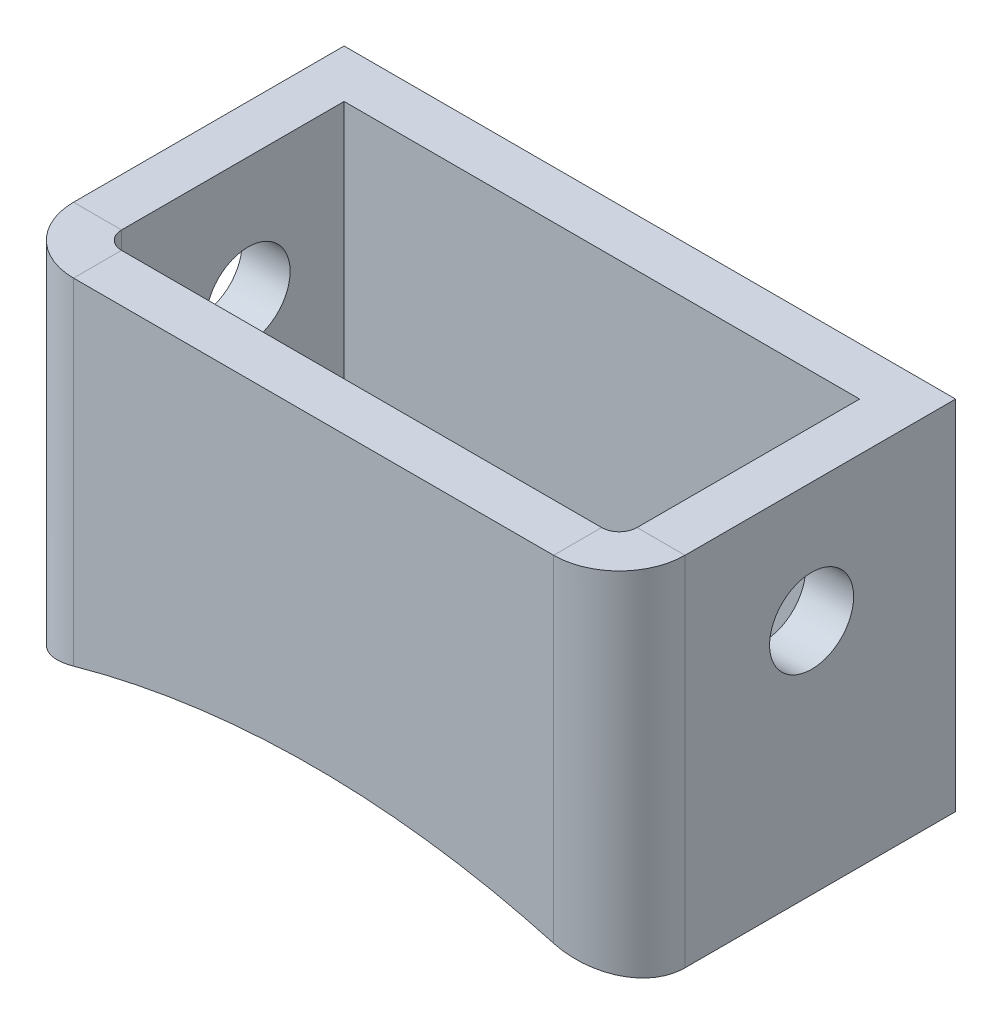
from build123d import *

# Parameters (mm, degrees)
SKETCH1_R                  = 1.75
BASE_FLANGE1_DEPTH         = 2
SKETCHED_START             = -8.2
SKETCHED_BEND1_DEPTH       = 15.2
SKETCHED_BEND1_2_DEPTH     = 8.4499999
SKETCHED_START_2           = 3.7500001
SKETCHED_BEND1_3_DEPTH     = 3.2499999
SKETCHED_START_3           = 0.2499999
SKETCHED_BEND1_4_DEPTH     = 3.5000002
SKETCHED_START_4           = -12.7366
SKETCHED_BEND1_5_OUTLINE_R = 1.75
SKETCHED_BEND1_5_DEPTH     = 25.4732
SKETCH7_R                  = 37
CUT_EXTRUDE1_DEPTH         = 20.330576261
BOSS_EXTRUDE1_DEPTH        = 2


with BuildPart() as part:
    # Base-Flange1: sheet metal written as solids
    # Sketch1 → Base-Flange1 (new body)
    with BuildSketch(Plane.XY):
        with BuildLine():
            Line((10, 7), (22, 7))
            Line((22, 7), (22, -8.2))
            Line((22, -8.2), (10, -8.2))
            Line((10, -8.2), (10, -7))
            ThreePointArc((10, -7), (0, -5.623026261), (-10, -7))
            Line((-10, -7), (-10, -8.2))
            Line((-10, -8.2), (-22, -8.2))
            Line((-22, -8.2), (-22, 7))
            Line((-22, 7), (-10, 7))
            Line((-10, 7), (10, 7))
        make_face()
        with Locations((18, 2)):
            Circle(SKETCH1_R, mode=Mode.SUBTRACT)
        with Locations(Location((-18, 2, 0), (0, 0, 180))):
            Circle(SKETCH1_R, mode=Mode.SUBTRACT)
    extrude(amount=-BASE_FLANGE1_DEPTH)

    # Sketched Bend1: read off the stored shape, not the designer's step
    # Sketched Bend1 outline → Sketched Bend1 (cut)
    with BuildSketch(Plane(origin=(0, 0, 0), x_dir=(1, 0, 0), z_dir=(0, 1, 0)).offset(SKETCHED_START)):
        with BuildLine():
            ThreePointArc((-10, 0), (-11.654267209, 0.556604688), (-12.635602398, 2))
            Line((-12.635602398, 2), (-22, 2))
            Line((-22, 2), (-22, 0))
            Line((-22, 0), (-10, 0))
        make_face()
        with BuildLine():
            Line((22, 2), (12.635602398, 2))
            ThreePointArc((12.635602398, 2), (11.654267209, 0.556604688), (10, 0))
            Line((10, 0), (22, 0))
            Line((22, 0), (22, 2))
        make_face()
    extrude(amount=SKETCHED_BEND1_DEPTH, mode=Mode.SUBTRACT)

    # Sketched Bend1 2 outline → Sketched Bend1 2 (add)
    with BuildSketch(Plane(origin=(0, 0, 0), x_dir=(1, 0, 0), z_dir=(0, 1, 0)).offset(SKETCHED_START)):
        with BuildLine():
            ThreePointArc((-10, 2), (-10.520854855, 2.215745145), (-10.7366, 2.7366))
            Line((-10.7366, 2.7366), (-10.7366, 12.008755099))
            Line((-10.7366, 12.008755099), (-12.7366, 12.008755099))
            Line((-12.7366, 12.008755099), (-12.7366, 2.7366))
            ThreePointArc((-12.7366, 2.7366), (-12.711233029, 2.364854094), (-12.635602398, 2))
            Line((-12.635602398, 2), (-10, 2))
        make_face()
        with BuildLine():
            ThreePointArc((10.7366, 2.7366), (10.520854855, 2.215745145), (10, 2))
            Line((10, 2), (12.635602398, 2))
            ThreePointArc((12.635602398, 2), (12.711233029, 2.364854094), (12.7366, 2.7366))
            Line((12.7366, 2.7366), (12.7366, 12.008755099))
            Line((12.7366, 12.008755099), (10.7366, 12.008755099))
            Line((10.7366, 12.008755099), (10.7366, 2.7366))
        make_face()
    extrude(amount=SKETCHED_BEND1_2_DEPTH)

    # Sketched Bend1 3 outline → Sketched Bend1 3 (add)
    with BuildSketch(Plane(origin=(0, 0, 0), x_dir=(1, 0, 0), z_dir=(0, 1, 0)).offset(SKETCHED_START_2)):
        with BuildLine():
            ThreePointArc((-10, 2), (-10.520854855, 2.215745145), (-10.7366, 2.7366))
            Line((-10.7366, 2.7366), (-10.7366, 12.008755099))
            Line((-10.7366, 12.008755099), (-12.7366, 12.008755099))
            Line((-12.7366, 12.008755099), (-12.7366, 2.7366))
            ThreePointArc((-12.7366, 2.7366), (-12.711233029, 2.364854094), (-12.635602398, 2))
            Line((-12.635602398, 2), (-10, 2))
        make_face()
        with BuildLine():
            ThreePointArc((10.7366, 2.7366), (10.520854855, 2.215745145), (10, 2))
            Line((10, 2), (12.635602398, 2))
            ThreePointArc((12.635602398, 2), (12.711233029, 2.364854094), (12.7366, 2.7366))
            Line((12.7366, 2.7366), (12.7366, 12.008755099))
            Line((12.7366, 12.008755099), (10.7366, 12.008755099))
            Line((10.7366, 12.008755099), (10.7366, 2.7366))
        make_face()
    extrude(amount=SKETCHED_BEND1_3_DEPTH)

    # Sketched Bend1 4 outline → Sketched Bend1 4 (add)
    with BuildSketch(Plane(origin=(0, 0, 0), x_dir=(1, 0, 0), z_dir=(0, 1, 0)).offset(SKETCHED_START_3)):
        with BuildLine():
            ThreePointArc((10.7366, 2.7366), (10.520854855, 2.215745145), (10, 2))
            Line((10, 2), (12.635602398, 2))
            ThreePointArc((12.635602398, 2), (12.711233029, 2.364854094), (12.7366, 2.7366))
            Line((12.7366, 2.7366), (12.7366, 12.008755099))
            Line((12.7366, 12.008755099), (10.7366, 12.008755099))
            Line((10.7366, 12.008755099), (10.7366, 2.7366))
        make_face()
        with BuildLine():
            ThreePointArc((-10, 2), (-10.520854855, 2.215745145), (-10.7366, 2.7366))
            Line((-10.7366, 2.7366), (-10.7366, 12.008755099))
            Line((-10.7366, 12.008755099), (-12.7366, 12.008755099))
            Line((-12.7366, 12.008755099), (-12.7366, 2.7366))
            ThreePointArc((-12.7366, 2.7366), (-12.711233029, 2.364854094), (-12.635602398, 2))
            Line((-12.635602398, 2), (-10, 2))
        make_face()
    extrude(amount=SKETCHED_BEND1_4_DEPTH)

    # Sketched Bend1 5 outline → Sketched Bend1 5 (cut)
    with BuildSketch(Plane.YZ.offset(SKETCHED_START_4)):
        with Locations((2, -8.008755099)):
            Circle(SKETCHED_BEND1_5_OUTLINE_R)
    extrude(amount=SKETCHED_BEND1_5_DEPTH, mode=Mode.SUBTRACT)

    # Sketch7 → Cut-Extrude1 (cut, through all)
    with BuildSketch(Plane.XY):
        with Locations((0, -42.623026261)):
            Circle(SKETCH7_R)
    extrude(amount=-CUT_EXTRUDE1_DEPTH, mode=Mode.SUBTRACT)

    # Sketch8 → Boss-Extrude1 (add)
    with BuildSketch(Plane(origin=(0, 0, -12.008755099), x_dir=(-1, 0, 0), z_dir=(0, 0, -1))):
        with BuildLine():
            Line((-12.7366, -7.884301177), (-12.7366, 7))
            Line((-12.7366, 7), (12.7366, 7))
            Line((12.7366, 7), (12.7366, -7.884301177))
            ThreePointArc((12.7366, -7.884301177), (0, -5.623026261), (-12.7366, -7.884301177))
        make_face()
    extrude(amount=BOSS_EXTRUDE1_DEPTH)


solid = part.part
